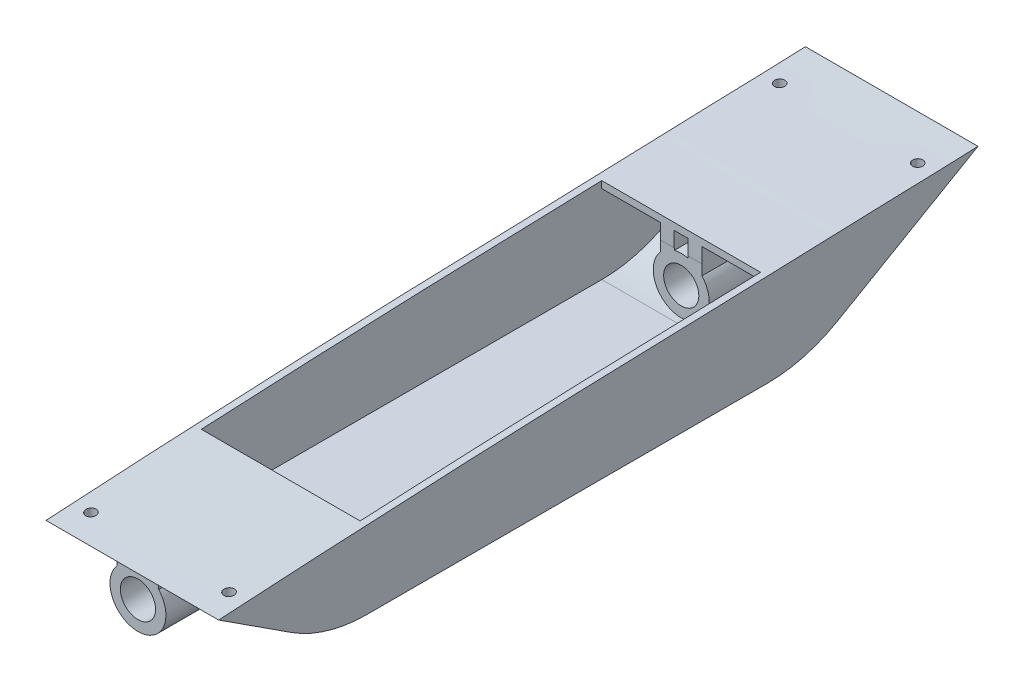
from build123d import *

# Parameters (mm, degrees)
SKETCH_1_W               = 50
SKETCH_1_H               = 300
EXTRUDE_1_DEPTH          = 80
CUT_EXTRUDE_2_DEPTH      = 172.828402774
CUT_EXTRUDE_2_DEPTH_BACK = 172.828402774
CUT_EXTRUDE_3_DEPTH      = 23
CUT_EXTRUDE_3_DEPTH_BACK = 23
EXTRUDE_START            = -100
EXTRUDE_2_OUTLINE_R      = 5.1
EXTRUDE_2_DEPTH          = 210
CUT_EXTRUDE_4_DEPTH      = 23
CUT_EXTRUDE_4_DEPTH_BACK = 23
SKETCH_20_W              = 116.049156789
SKETCH_20_H              = 18.455999994
CUT_EXTRUDE_5_DEPTH      = 134.574883329
CUT_EXTRUDE_5_DEPTH_BACK = 134.574883329
SKETCH_21_R              = 5.1
SKETCH_24_W              = 46
SKETCH_24_H              = 116
CUT_EXTRUDE_6_DEPTH      = 117.139321632
CUT_EXTRUDE_7_DEPTH      = 117.139321632
CUT_EXTRUDE_7_DEPTH_BACK = 117.139321632
SKETCH_25_R              = 1.5
SKETCH_26_R              = 1.5
CUT_EXTRUDE_8_DEPTH      = 116.962885935


# Read off the part's stored shape, not the designer's step: 凸台-拉伸2
with BuildPart() as part:
    # 草图1 → 凸台-拉伸1 (new body)
    with BuildSketch(Plane(origin=(0, 0, 0), x_dir=(1, 0, 0), z_dir=(0, 1, 0))):
        Rectangle(SKETCH_1_W, SKETCH_1_H)
    extrude(amount=EXTRUDE_1_DEPTH)

    # 草图2 → 切除-拉伸2 (cut, two sides: drawn at the far end of the back side and taken through both)
    with BuildSketch(Plane(origin=(0, 0, 0), x_dir=(0, 0, -1), z_dir=(1, 0, 0)).offset(-CUT_EXTRUDE_2_DEPTH_BACK)):
        Polygon((150, 0), (150, 78.524916774), (150, 80), (-150, 80), (-150, 59.462807116), (-150, 0), align=None)
        with BuildLine():
            Line((108.360661065, 68.948585319), (67.605076559, 45.418337633))
            ThreePointArc((67.605076559, 45.418337633), (57.850989731, 41.37806258), (47.38356522, 40))
            Line((47.38356522, 40), (-68.665591569, 40))
            ThreePointArc((-68.665591569, 40), (-80.13307712, 41.659845159), (-90.659275442, 46.503135333))
            Line((-90.659275442, 46.503135333), (-111.639338935, 60.098610162))
            add(Edge.make_bspline(
                [(108.360661065, 68.948585319), (107.965622467, 68.928378842), (107.030734505, 68.881776654), (102.934111113, 68.691333879), (96.067292659, 68.475320134), (86.605526814, 68.227288469), (77.142047792, 67.904946747), (67.677018748, 67.560026228), (55.05215798, 67.099106828), (39.268780145, 66.581617815), (20.329050365, 66.017633997), (1.394462668, 65.453177335), (-17.534085622, 64.79296623), (-36.456045966, 64.005514315), (-55.377017997, 63.097218952), (-74.3020235, 62.188400226), (-91.476284312, 61.299207639), (-103.920389715, 60.560605384), (-110.063251015, 60.192633393), (-111.639338935, 60.098610162)],
                knots=[0.579300205, 0.579300205, 0.579300205, 0.579300205, 0.581226783, 0.583859049, 0.599271677, 0.614684305, 0.630096932, 0.64550956, 0.660922188, 0.691747444, 0.722572699, 0.753397955, 0.784223211, 0.815048466, 0.845873722, 0.876698977, 0.907524233, 0.929854896, 0.93756121, 0.93756121, 0.93756121, 0.93756121], degree=3))
        make_face(mode=Mode.SUBTRACT)
    extrude(amount=CUT_EXTRUDE_2_DEPTH + CUT_EXTRUDE_2_DEPTH_BACK, mode=Mode.SUBTRACT)

    # 草图18 → 切除-拉伸3 (cut, two sides: drawn at the far end of the back side and taken through both)
    with BuildSketch(Plane(origin=(0, 0, 0), x_dir=(0, 0, -1), z_dir=(1, 0, 0)).offset(-CUT_EXTRUDE_3_DEPTH_BACK)):
        with BuildLine():
            ThreePointArc((47.38356522, 42), (57.33335164, 43.309914233), (66.605076559, 47.15038844))
            Line((66.605076559, 47.15038844), (93.012321779, 62.396618577))
            Line((93.012321779, 62.396618577), (93.012321779, 66.396618577))
            add(Edge.make_bspline(
                [(93.012321779, 66.396618577), (92.405079993, 66.379724006), (90.544740429, 66.328136355), (84.396698438, 66.155354811), (74.591159401, 65.814099359), (61.719039922, 65.336927185), (44.549345936, 64.742483261), (23.08990756, 64.096605129), (-2.637754479, 63.336155637), (-28.339539042, 62.380139926), (-54.042977758, 61.159767807), (-76.812960161, 60.074085172), (-91.57646926, 59.27666016), (-97.780842881, 58.917328275), (-98.369984773, 58.883034573)],
                knots=[0.604340928, 0.604340928, 0.604340928, 0.604340928, 0.607305803, 0.613429651, 0.634377874, 0.655326097, 0.67627432, 0.718170766, 0.760067213, 0.801963659, 0.843860105, 0.885756551, 0.913237903, 0.916120922, 0.916120922, 0.916120922, 0.916120922], degree=3))
            Line((-98.369984773, 58.883034573), (-98.369984773, 53.883034573))
            Line((-98.369984773, 53.883034573), (-89.571637455, 48.181540412))
            ThreePointArc((-89.571637455, 48.181540412), (-79.565983723, 43.577762018), (-68.665591569, 42))
            Line((-68.665591569, 42), (47.38356522, 42))
        make_face()
    extrude(amount=CUT_EXTRUDE_3_DEPTH + CUT_EXTRUDE_3_DEPTH_BACK, mode=Mode.SUBTRACT)

    # 凸台-拉伸2 outline → 凸台-拉伸2 (add)
    with BuildSketch(Plane.XY.offset(EXTRUDE_START)):
        with BuildLine():
            Line((6, 68.948585319), (2, 68.948585319))
            Line((2, 68.948585319), (2, 59.847813943))
            ThreePointArc((2, 59.847813943), (0, 60.098610162), (-2, 59.847813943))
            Line((-2, 59.847813943), (-2, 68.948585319))
            Line((-2, 68.948585319), (-6, 68.948585319))
            Line((-6, 68.948585319), (-6, 57.440117306))
            ThreePointArc((-6, 57.440117306), (0, 43.898610162), (6, 57.440117306))
            Line((6, 57.440117306), (6, 68.948585319))
        make_face()
        with Locations((0, 51.998610162)):
            Circle(EXTRUDE_2_OUTLINE_R, mode=Mode.SUBTRACT)
    extrude(amount=EXTRUDE_2_DEPTH)

    # 草图20 → 切除-拉伸4 (cut, two sides: drawn at the far end of the back side and taken through both)
    with BuildSketch(Plane(origin=(0, 0, 0), x_dir=(0, 0, -1), z_dir=(1, 0, 0)).offset(-CUT_EXTRUDE_4_DEPTH_BACK)):
        with BuildLine():
            Line((-110, 60.196521261), (-110, 68.948585319))
            Line((-110, 68.948585319), (100, 68.948585319))
            Line((100, 68.948585319), (99.999999992, 68.603581586))
            add(Edge.make_bspline(
                [(-110, 60.196521261), (-108.970400487, 60.258071068), (-103.374083081, 60.593030641), (-91.476284312, 61.299207639), (-74.3020235, 62.188400226), (-55.377017997, 63.097218952), (-36.456045966, 64.005514315), (-17.534085622, 64.79296623), (1.394462668, 65.453177335), (20.329050365, 66.017633997), (39.268780145, 66.581617815), (55.05215798, 67.099106828), (67.677018748, 67.560026228), (77.142047792, 67.904946747), (86.605526814, 68.227288469), (94.220116006, 68.426898063), (98.690149016, 68.560665287), (99.999999992, 68.603581586)],
                knots=[0.592885856, 0.592885856, 0.592885856, 0.592885856, 0.597920267, 0.620250931, 0.651076186, 0.681901442, 0.712726698, 0.743551953, 0.774377209, 0.805202464, 0.83602772, 0.866852976, 0.882265604, 0.897678231, 0.913090859, 0.928503487, 0.934889307, 0.934889307, 0.934889307, 0.934889307], degree=3))
        make_face()
        with Locations((-10.641013174, 51.227999997)):
            Rectangle(SKETCH_20_W, SKETCH_20_H)
    extrude(amount=CUT_EXTRUDE_4_DEPTH + CUT_EXTRUDE_4_DEPTH_BACK, mode=Mode.SUBTRACT)

    # 草图21 → 切除-拉伸5 (cut, two sides: drawn at the far end of the back side and taken through both)
    with BuildSketch(Plane.XY.offset(-CUT_EXTRUDE_5_DEPTH_BACK)):
        with Locations((0, 51.998610162)):
            Circle(SKETCH_21_R)
        with BuildLine():
            Line((-13, 54.498610162), (-13, 49.498610162))
            ThreePointArc((-13, 49.498610162), (-15, 47.498610162), (-17, 49.498610162))
            Line((-17, 49.498610162), (-17, 54.498610162))
            ThreePointArc((-17, 54.498610162), (-15, 56.498610162), (-13, 54.498610162))
        make_face()
        with BuildLine():
            Line((13, 54.498610162), (13, 49.498610162))
            ThreePointArc((13, 49.498610162), (15, 47.498610162), (17, 49.498610162))
            Line((17, 49.498610162), (17, 54.498610162))
            ThreePointArc((17, 54.498610162), (15, 56.498610162), (13, 54.498610162))
        make_face()
    extrude(amount=CUT_EXTRUDE_5_DEPTH + CUT_EXTRUDE_5_DEPTH_BACK, mode=Mode.SUBTRACT)

    # 草图24 → 切除-拉伸6 (cut, through all)
    with BuildSketch(Plane(origin=(0, 60, 0), x_dir=(1, 0, 0), z_dir=(0, 1, 0))):
        with Locations((0, -10.639338935)):
            Rectangle(SKETCH_24_W, SKETCH_24_H)
    extrude(amount=CUT_EXTRUDE_6_DEPTH, mode=Mode.SUBTRACT)

    # 草图25 → 切除-拉伸7 (cut, two sides: drawn at the far end of the back side and taken through both)
    with BuildSketch(Plane(origin=(0, 60, 0), x_dir=(1, 0, 0), z_dir=(0, 1, 0)).offset(-CUT_EXTRUDE_7_DEPTH_BACK)):
        with Locations(Location((-20, 95.896809173, 0), (0, 0, 270))):
            Circle(SKETCH_25_R)
        with Locations(Location((20, 95.896809173, 0), (0, 0, 270))):
            Circle(SKETCH_25_R)
        with Locations(Location((20, -103.616000879, 0), (0, 0, 270))):
            Circle(SKETCH_25_R)
        with Locations(Location((-20, -103.616000879, 0), (0, 0, 270))):
            Circle(SKETCH_25_R)
    extrude(amount=CUT_EXTRUDE_7_DEPTH + CUT_EXTRUDE_7_DEPTH_BACK, mode=Mode.SUBTRACT)

    # 草图26 → 切除-拉伸8 (cut, through all)
    with BuildSketch(Plane(origin=(0, 50, 0), x_dir=(1, 0, 0), z_dir=(0, 1, 0))):
        with Locations(Location((0, -100, 0), (0, 0, 270))):
            Circle(SKETCH_26_R)
        with Locations(Location((0, 90, 0), (0, 0, 270))):
            Circle(SKETCH_26_R)
    extrude(amount=-CUT_EXTRUDE_8_DEPTH, mode=Mode.SUBTRACT)


solid = part.part
